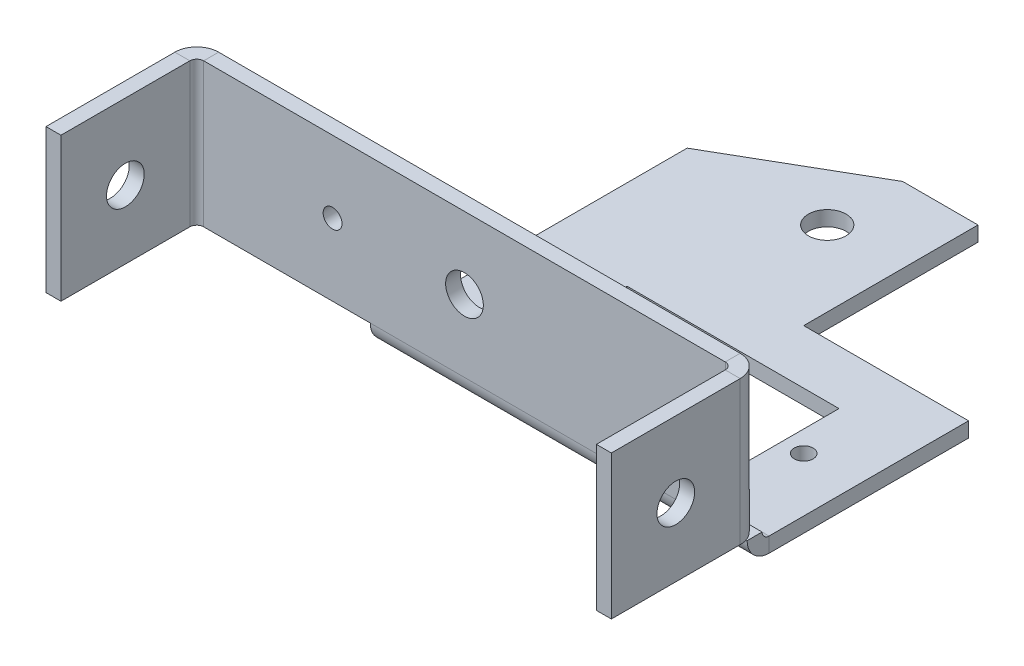
from build123d import *

# Parameters (mm, degrees)
SKETCH1_R                    = 2
SKETCH1_R_2                  = 1
SKETCH1_W                    = 22.5
SKETCH1_H                    = 12
BASE_FLANGE1_DEPTH           = 1.5875
EDGE_FLANGE1_STRIP_W         = 7.8232
EDGE_FLANGE1_STRIP_H         = 1.5875
EDGE_FLANGE1_STRIP_CUT_DEPTH = 40
EDGE_FLANGE1_DEPTH           = 40
EDGE_FLANGE1_PROFILE_W       = 60
EDGE_FLANGE1_PROFILE_H       = 15.2634
EDGE_FLANGE1_FLAT_DEPTH      = 1.5875
SKETCH11_R                   = 2
SKETCH11_R_2                 = 1
CUT_EXTRUDE1_DEPTH           = 61.789967563
EDGE_FLANGE2_STRIP_W         = 7.8232
EDGE_FLANGE2_STRIP_H         = 1.5875
EDGE_FLANGE2_STRIP_CUT_DEPTH = 15.2634
EDGE_FLANGE2_DEPTH           = 15.2634
SKETCH15_R                   = 2
CUT_EXTRUDE2_DEPTH           = 73.755464786


# Sheet-metal steps are written as plain solids
with BuildPart() as part:
    # Sketch1 → Base-Flange1 (new body)
    with BuildSketch(Plane(origin=(0, 0, 0), x_dir=(1, 0, 0), z_dir=(0, 1, 0))):
        Polygon((0, 0), (17.5, 0), (17.5, -23.5), (-22.5, -23.5), (-22.5, 10.128421097), (-8, 18.5), (0, 18.5), align=None)
        with Locations(Location((-8, 10.5, 0), (0, 0, 270))):
            Circle(SKETCH1_R, mode=Mode.SUBTRACT)
        with Locations(Location((11.75, -11.75, 0), (0, 0, 270))):
            Circle(SKETCH1_R_2, mode=Mode.SUBTRACT)
        with Locations(Location((-15.25, -11.75, 0), (0, 0, 270))):
            Circle(SKETCH1_R_2, mode=Mode.SUBTRACT)
        with Locations((-1.75, -11.75)):
            Rectangle(SKETCH1_W, SKETCH1_H, mode=Mode.SUBTRACT)
    extrude(amount=-BASE_FLANGE1_DEPTH)

    # Edge-Flange1 strip (across the edge) → Edge-Flange1 strip cut (cut)
    with BuildSketch(Plane(origin=(-22.5, 0, 23.5), x_dir=(0, 0, -1), z_dir=(1, 0, 0))):
        with Locations((-1.5875, -0.79375)):
            Rectangle(EDGE_FLANGE1_STRIP_W, EDGE_FLANGE1_STRIP_H)
    extrude(amount=EDGE_FLANGE1_STRIP_CUT_DEPTH, mode=Mode.SUBTRACT)

    # Edge-Flange1 bend section (across the edge) → Edge-Flange1 (add)
    with BuildSketch(Plane(origin=(-22.5, 0, 23.5), x_dir=(0, 0, -1), z_dir=(1, 0, 0))):
        with BuildLine():
            Line((0, 0.7366), (1.5875, 0.7366))
            ThreePointArc((1.5875, 0.7366), (1.803245145, 0.215745145), (2.3241, 0))
            Line((2.3241, 0), (2.3241, -1.5875))
            ThreePointArc((2.3241, -1.5875), (0.68071313, -0.90678687), (0, 0.7366))
        make_face()
    extrude(amount=EDGE_FLANGE1_DEPTH)

    # Edge-Flange1 profile (on flange) → Edge-Flange1 flat (add)
    with BuildSketch(Plane.XY.offset(23.5)):
        with Locations((-12.5, 8.3683)):
            Rectangle(EDGE_FLANGE1_PROFILE_W, EDGE_FLANGE1_PROFILE_H)
    extrude(amount=-EDGE_FLANGE1_FLAT_DEPTH)

    # Sketch11 → Cut-Extrude1 (cut, through all)
    with BuildSketch(Plane(origin=(0, 0, 21.9125), x_dir=(-1, 0, 0), z_dir=(0, 0, -1))):
        with Locations((12.5, 8.3683)):
            Circle(SKETCH11_R)
        with Locations((26.5, 8.3683)):
            Circle(SKETCH11_R_2)
    extrude(amount=-CUT_EXTRUDE1_DEPTH, mode=Mode.SUBTRACT)

    # Edge-Flange2 strip (across the edge) → Edge-Flange2 strip cut (cut)
    with BuildSketch(Plane(origin=(-42.5, 16, 23.5), x_dir=(1, 0, 0), z_dir=(0, -1, 0))):
        with Locations((-1.5875, -0.79375)):
            Rectangle(EDGE_FLANGE2_STRIP_W, EDGE_FLANGE2_STRIP_H)
    edge_flange2_strip_cut = extrude(amount=EDGE_FLANGE2_STRIP_CUT_DEPTH, mode=Mode.SUBTRACT)

    # Edge-Flange2 section (across the edge) → Edge-Flange2 (add)
    with BuildSketch(Plane(origin=(-42.5, 16, 23.5), x_dir=(1, 0, 0), z_dir=(0, -1, 0))):
        with BuildLine():
            Line((0, 0.7366), (0, 14.4125))
            Line((0, 14.4125), (1.5875, 14.4125))
            Line((1.5875, 14.4125), (1.5875, 0.7366))
            ThreePointArc((1.5875, 0.7366), (1.803245145, 0.215745145), (2.3241, 0))
            Line((2.3241, 0), (2.3241, -1.5875))
            ThreePointArc((2.3241, -1.5875), (0.68071313, -0.90678687), (0, 0.7366))
        make_face()
    edge_flange2 = extrude(amount=EDGE_FLANGE2_DEPTH)

    # Sketch15 → Cut-Extrude2 (cut, through all)
    with BuildSketch(Plane.ZY.offset(42.5)):
        with Locations((31.07455, 8)):
            Circle(SKETCH15_R)
    cut_extrude2 = extrude(amount=-CUT_EXTRUDE2_DEPTH, mode=Mode.SUBTRACT)

    # Mirror1: Edge-Flange2 strip cut, Edge-Flange2, Cut-Extrude2 across plane
    add(edge_flange2_strip_cut.mirror(Plane.ZY.offset(12.5)), mode=Mode.SUBTRACT)
    add(edge_flange2.mirror(Plane.ZY.offset(12.5)))
    add(cut_extrude2.mirror(Plane.ZY.offset(12.5)), mode=Mode.SUBTRACT)


solid = part.part
